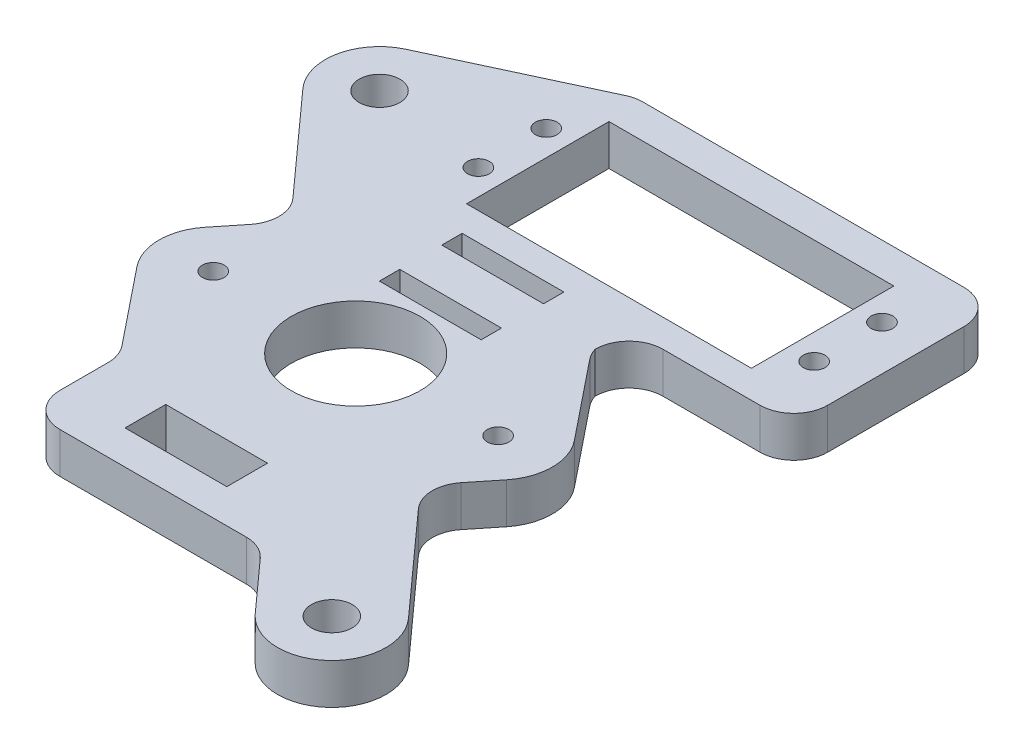
from build123d import *

# Parameters (mm, degrees)
ESBO_O1_R                = 3
ESBO_O1_R_2              = 1.6
ESBO_O1_W                = 15
ESBO_O1_H                = 3
ESBO_O1_W_2              = 42
ESBO_O1_H_2              = 21
ESBO_O1_R_3              = 9.5
ESBO_O1_H_3              = 6
RESSALTO_EXTRUS_O1_DEPTH = 6
FILETE1_R                = 5


with BuildPart() as part:
    # Esboço1 → Ressalto-extrusão1 (new body)
    with BuildSketch(Plane.XZ.offset(6)):
        with BuildLine():
            ThreePointArc((28.221137594, -123.946334359), (26.32780231, -130.898758331), (30.793557575, -136.55366306))
            Line((30.793557575, -136.55366306), (52.89462836, -146.829127406))
            ThreePointArc((52.89462836, -146.829127406), (53.923154275, -147.177291613), (55.00259, -147.2952))
            Line((55.00259, -147.2952), (102.35259, -147.2952))
            ThreePointArc((102.35259, -147.2952), (105.888123906, -145.830733906), (107.35259, -142.2952))
            Line((107.35259, -142.2952), (107.35259, -122.2))
            ThreePointArc((107.35259, -122.2), (105.888123906, -118.664466094), (102.35259, -117.2))
            Line((102.35259, -117.2), (88.05, -117.2))
            ThreePointArc((88.05, -117.2), (84.514466094, -115.735533906), (83.05, -112.2))
            Line((83.05, -112.2), (83.05, -111.6301581))
            Line((83.05, -111.6301581), (93.187089706, -99.009861475))
            ThreePointArc((93.187089706, -99.009861475), (94.95, -94), (93.187089706, -88.990138525))
            Line((93.187089706, -88.990138525), (87.547626436, -81.969218188))
            Line((87.547626436, -81.969218188), (103.678862406, -64.053665641))
            ThreePointArc((103.678862406, -64.053665641), (103.086748653, -52.755462186), (91.788545198, -53.347575939))
            Line((91.788545198, -53.347575939), (85.037246259, -60.845653032))
            ThreePointArc((85.037246259, -60.845653032), (83.355205347, -62.067727288), (81.321522132, -62.5))
            Line((81.321522132, -62.5), (53.85, -62.5))
            ThreePointArc((53.85, -62.5), (50.314466094, -63.964466094), (48.85, -67.5))
            Line((48.85, -67.5), (48.85, -76.3698419))
            Line((48.85, -76.3698419), (38.712910294, -88.990138525))
            ThreePointArc((38.712910294, -88.990138525), (36.95, -94), (38.712910294, -99.009861475))
            Line((38.712910294, -99.009861475), (44.352373564, -106.030781812))
            Line((44.352373564, -106.030781812), (28.221137594, -123.946334359))
        make_face()
        with Locations(Location((34.166296198, -129.29937921, 0), (0, 0, 270))):
            Circle(ESBO_O1_R, mode=Mode.SUBTRACT)
        with Locations(Location((51.25259, -136.7952, 0), (0, 0, 270))):
            Circle(ESBO_O1_R_2, mode=Mode.SUBTRACT)
        with Locations(Location((51.25259, -126.7952, 0), (0, 0, 270))):
            Circle(ESBO_O1_R_2, mode=Mode.SUBTRACT)
        with Locations((65.95, -115.7)):
            Rectangle(ESBO_O1_W, ESBO_O1_H, mode=Mode.SUBTRACT)
        with Locations((65.95, -106.5)):
            Rectangle(ESBO_O1_W, ESBO_O1_H, mode=Mode.SUBTRACT)
        with Locations((76.00259, -131.7952)):
            Rectangle(ESBO_O1_W_2, ESBO_O1_H_2, mode=Mode.SUBTRACT)
        with Locations(Location((100.75259, -136.7952, 0), (0, 0, 270))):
            Circle(ESBO_O1_R_2, mode=Mode.SUBTRACT)
        with Locations(Location((100.75259, -126.7952, 0), (0, 0, 270))):
            Circle(ESBO_O1_R_2, mode=Mode.SUBTRACT)
        with Locations(Location((65.95, -94, 0), (0, 0, 270))):
            Circle(ESBO_O1_R_3, mode=Mode.SUBTRACT)
        with Locations((65.95, -70.5)):
            Rectangle(ESBO_O1_W, ESBO_O1_H_3, mode=Mode.SUBTRACT)
        with Locations(Location((97.733703802, -58.70062079, 0), (0, 0, 270))):
            Circle(ESBO_O1_R, mode=Mode.SUBTRACT)
        with Locations(Location((44.95, -94, 0), (0, 0, 270))):
            Circle(ESBO_O1_R_2, mode=Mode.SUBTRACT)
        with Locations(Location((86.95, -94, 0), (0, 0, 270))):
            Circle(ESBO_O1_R_2, mode=Mode.SUBTRACT)
    extrude(amount=-RESSALTO_EXTRUS_O1_DEPTH)

    # Filete1
    # the kernel refuses this fillet: 5 mm, written as the material it adds along each edge
    with BuildSketch(Plane(origin=(83.05, -6, -111.6301581), x_dir=(0, 0, -1), z_dir=(0, 1, 0))) as filete1_piece_1:
        with BuildLine():
            CenterArc((2.031271709, -4.78165483), FILETE1_R, 106.994862895, 21.777857611)
            Line((-1.099891712, -0.883473763), (-1.162514981, -0.805510142))
            Line((-1.162514981, -0.805510142), (-0.062623268, 0.077963621))
            Line((-0.062623268, 0.077963621), (0, 0.1))
            ThreePointArc((0, 0.1), (0.28492095, 0.1), (0.540613304, 0.095633097))
            Line((0.540613304, 0.095633097), (0.5698419, 0))
        make_face()
    extrude(amount=6)
    with BuildSketch(Plane(origin=(87.547626436, -6, -81.969218188), x_dir=(0.626232684317403, 0, -0.7796362133024736), z_dir=(0, 1, 0)), Plane(origin=(44.352373564, -6, -106.030781812), x_dir=(-0.6262326843177314, 0, 0.7796362133022096), z_dir=(0, 1, 0))) as filete1_piece_2:
        with BuildLine():
            CenterArc((FILETE1_R * 0.85065630428, -FILETE1_R), FILETE1_R, 90, 80.772720506)
            Line((-FILETE1_R * 0.136403726762, -FILETE1_R * 0.839648838109), (-FILETE1_R * 0.156144927382, -FILETE1_R * 0.836441814871))
            Line((-FILETE1_R * 0.156144927382, -FILETE1_R * 0.836441814871), (-FILETE1_R * 0.0170131260856, FILETE1_R * 0.02))
            Line((-FILETE1_R * 0.0170131260856, FILETE1_R * 0.02), (FILETE1_R * 0.85065630428, FILETE1_R * 0.02))
            Line((FILETE1_R * 0.85065630428, FILETE1_R * 0.02), (FILETE1_R * 0.85065630428, 0))
        make_face()
    extrude(amount=6)
    with BuildSketch(Plane(origin=(48.85, -6, -76.3698419), x_dir=(0, 0, 1), z_dir=(0, 1, 0))) as filete1_piece_3:
        with BuildLine():
            CenterArc((FILETE1_R * 0.351888031743, -FILETE1_R), FILETE1_R, 90, 38.772720506)
            Line((-FILETE1_R * 0.274344652575, -FILETE1_R * 0.220363786698), (-FILETE1_R * 0.286869306261, -FILETE1_R * 0.204771062432))
            Line((-FILETE1_R * 0.286869306261, -FILETE1_R * 0.204771062432), (-FILETE1_R * 0.00703776063486, FILETE1_R * 0.02))
            Line((-FILETE1_R * 0.00703776063486, FILETE1_R * 0.02), (FILETE1_R * 0.351888031743, FILETE1_R * 0.02))
            Line((FILETE1_R * 0.351888031743, FILETE1_R * 0.02), (FILETE1_R * 0.351888031743, 0))
        make_face()
    extrude(amount=6)


solid = part.part
